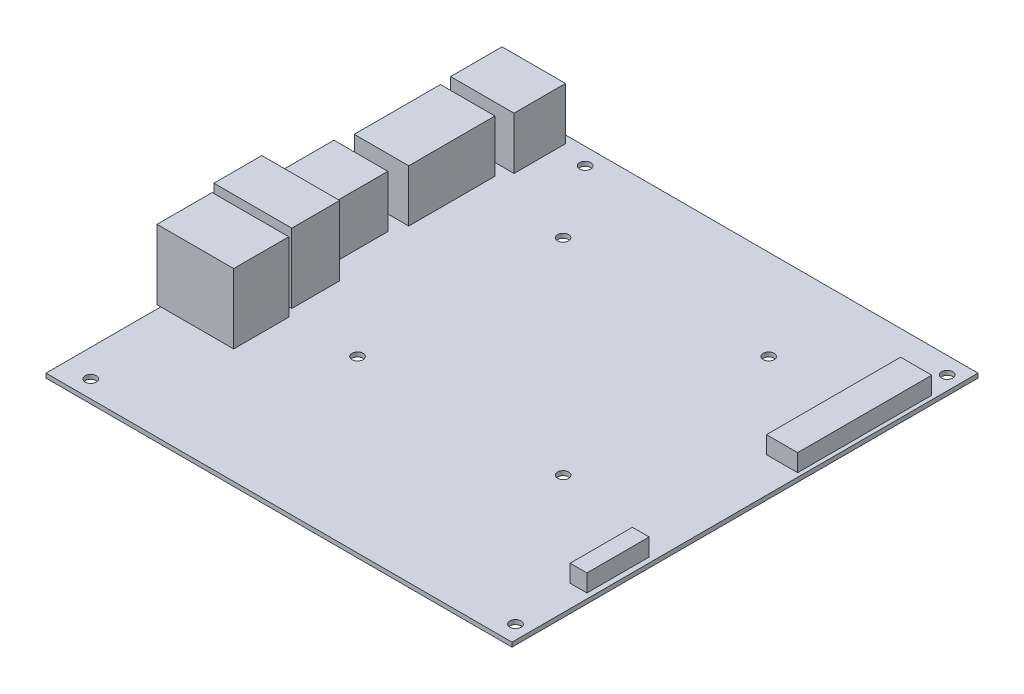
from build123d import *

# Parameters (mm, degrees)
SKETCH1_W                     = 170
SKETCH1_H                     = 170
BOSS_EXTRUDE1_DEPTH           = 1.5875
SKETCH2_W                     = 19.874317931
SKETCH2_H                     = 31.449470131
VGA_DEPTH                     = 19.05
SKETCH3_W                     = 19.655918832
SKETCH3_H                     = 22.058308912
HDMI_DEPTH                    = 19.05
SKETCH4_W                     = 28.391882757
SKETCH4_H                     = 17.471927851
USB_1_DEPTH                   = 25.4
SKETCH5_W                     = 27.955084562
SKETCH5_H                     = 20.092717029
ETH_USB_2_DEPTH               = 25.4
SKETCH6_W                     = 6.115174748
SKETCH6_H                     = 22.713506206
FRONT_USB_3_HEADER_DEPTH      = 6.35
SKETCH7_W                     = 11.356753103
SKETCH7_H                     = 48.921397982
ATX_DEPTH                     = 6.35
SKETCH8_W                     = 23.150304402
SKETCH8_H                     = 18.78232244
USB_MOUSE_DEPTH               = 19.05
SKETCH9_R                     = 2.015
LGA_1150_MOUNTING_HOLES_DEPTH = 126.64606768
MAIN_MOUNTING_HOLES_OUTLINE_R = 2.032
MAIN_MOUNTING_HOLES_DEPTH     = 1.5875


# Read off the part's stored shape, not the designer's step: Main Mounting holes
with BuildPart() as part:
    # Sketch1 → Boss-Extrude1 (new body)
    with BuildSketch(Plane(origin=(0, 0, 0), x_dir=(1, 0, 0), z_dir=(0, 1, 0))):
        Rectangle(SKETCH1_W, SKETCH1_H)
    extrude(amount=BOSS_EXTRUDE1_DEPTH)

    # Sketch2 → VGA (add)
    with BuildSketch(Plane(origin=(0, 1.5875, 0), x_dir=(1, 0, 0), z_dir=(0, 1, 0))):
        with Locations((-75.238489308, 43.35222098)):
            Rectangle(SKETCH2_W, SKETCH2_H)
    extrude(amount=VGA_DEPTH)

    # Sketch3 → HDMI (add)
    with BuildSketch(Plane(origin=(0, 1.5875, 0), x_dir=(1, 0, 0), z_dir=(0, 1, 0))):
        with Locations((-77.182705778, 11.029154456)):
            Rectangle(SKETCH3_W, SKETCH3_H)
    extrude(amount=HDMI_DEPTH)

    # Sketch4 → USB_1 (add)
    with BuildSketch(Plane(origin=(0, 1.5875, 0), x_dir=(1, 0, 0), z_dir=(0, 1, 0))):
        with Locations((-74.780315699, -11.029154456)):
            Rectangle(SKETCH4_W, SKETCH4_H)
    extrude(amount=USB_1_DEPTH)

    # Sketch5 → ETH_USB_2 (add)
    with BuildSketch(Plane(origin=(0, 1.5875, 0), x_dir=(1, 0, 0), z_dir=(0, 1, 0))):
        with Locations((-72.377925619, -33.087463367)):
            Rectangle(SKETCH5_W, SKETCH5_H)
    extrude(amount=ETH_USB_2_DEPTH)

    # Sketch6 → Front USB 3 Header (add)
    with BuildSketch(Plane(origin=(0, 1.5875, 0), x_dir=(1, 0, 0), z_dir=(0, 1, 0))):
        with Locations((80.064644879, -44.44421647)):
            Rectangle(SKETCH6_W, SKETCH6_H)
    extrude(amount=FRONT_USB_3_HEADER_DEPTH)

    # Sketch7 → ATX (add)
    with BuildSketch(Plane(origin=(0, 1.5875, 0), x_dir=(1, 0, 0), z_dir=(0, 1, 0))):
        with Locations((77.880653897, 45.099413765)):
            Rectangle(SKETCH7_W, SKETCH7_H)
    extrude(amount=ATX_DEPTH)

    # Sketch8 → USB_MOUSE (add)
    with BuildSketch(Plane(origin=(0, 1.5875, 0), x_dir=(1, 0, 0), z_dir=(0, 1, 0))):
        with Locations((-74.278230021, 72.836099228)):
            Rectangle(SKETCH8_W, SKETCH8_H)
    extrude(amount=USB_MOUSE_DEPTH)

    # Sketch9 → LGA 1150 Mounting holes (cut, through all)
    with BuildSketch(Plane(origin=(0, 1.5875, 0), x_dir=(1, 0, 0), z_dir=(0, 1, 0))):
        with Locations(Location((-33.43759867, 52.088184905, 0), (0, 0, 270))):
            Circle(SKETCH9_R)
        with Locations(Location((41.56240133, 52.088184905, 0), (0, 0, 270))):
            Circle(SKETCH9_R)
        with Locations(Location((41.56240133, -22.911815095, 0), (0, 0, 270))):
            Circle(SKETCH9_R)
        with Locations(Location((-33.43759867, -22.911815095, 0), (0, 0, 270))):
            Circle(SKETCH9_R)
    extrude(amount=-LGA_1150_MOUNTING_HOLES_DEPTH, mode=Mode.SUBTRACT)

    # Main Mounting holes outline → Main Mounting holes (cut)
    with BuildSketch(Plane(origin=(0, 0, 0), x_dir=(1, 0, 0), z_dir=(0, 1, 0))):
        with Locations((79.924351727, 78.83)):
            Circle(MAIN_MOUNTING_HOLES_OUTLINE_R)
        with Locations((79.924351727, -78.65)):
            Circle(MAIN_MOUNTING_HOLES_OUTLINE_R)
        with Locations((-75.015648273, -78.65)):
            Circle(MAIN_MOUNTING_HOLES_OUTLINE_R)
        with Locations((-52.155648273, 78.83)):
            Circle(MAIN_MOUNTING_HOLES_OUTLINE_R)
    extrude(amount=MAIN_MOUNTING_HOLES_DEPTH, mode=Mode.SUBTRACT)


solid = part.part
